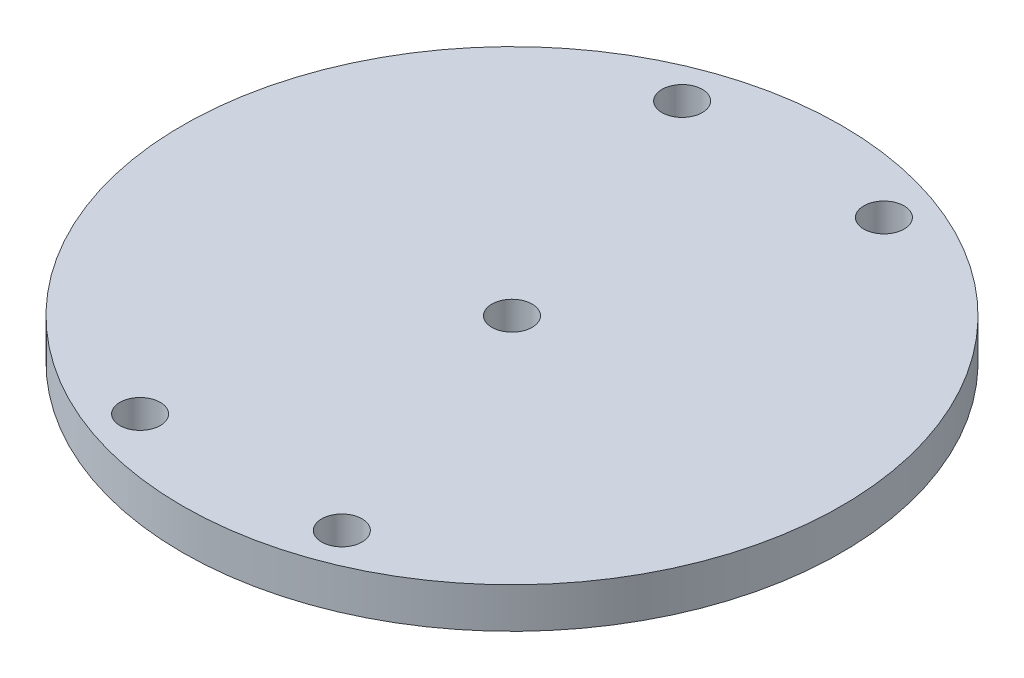
from build123d import *

# Parameters (mm, degrees)
SKETCH1_R           = 49
BOSS_EXTRUDE1_DEPTH = 6
SKETCH2_R           = 3
CUT_EXTRUDE1_DEPTH  = 6


with BuildPart() as part:
    # Sketch1 → Boss-Extrude1 (new body)
    with BuildSketch(Plane(origin=(0, 0, 0), x_dir=(1, 0, 0), z_dir=(0, 1, 0))):
        Circle(SKETCH1_R)
    extrude(amount=BOSS_EXTRUDE1_DEPTH)

    # Sketch2 → Cut-Extrude1 (cut)
    with BuildSketch(Plane(origin=(0, 6, 0), x_dir=(1, 0, 0), z_dir=(0, 1, 0))):
        Circle(SKETCH2_R)
        with Locations((-15, 40.298883359)):
            Circle(SKETCH2_R)
        with Locations((15, 40.298883359)):
            Circle(SKETCH2_R)
        with Locations((-15, -40.298883359)):
            Circle(SKETCH2_R)
        with Locations((15, -40.298883359)):
            Circle(SKETCH2_R)
    extrude(amount=-CUT_EXTRUDE1_DEPTH, mode=Mode.SUBTRACT)


solid = part.part
